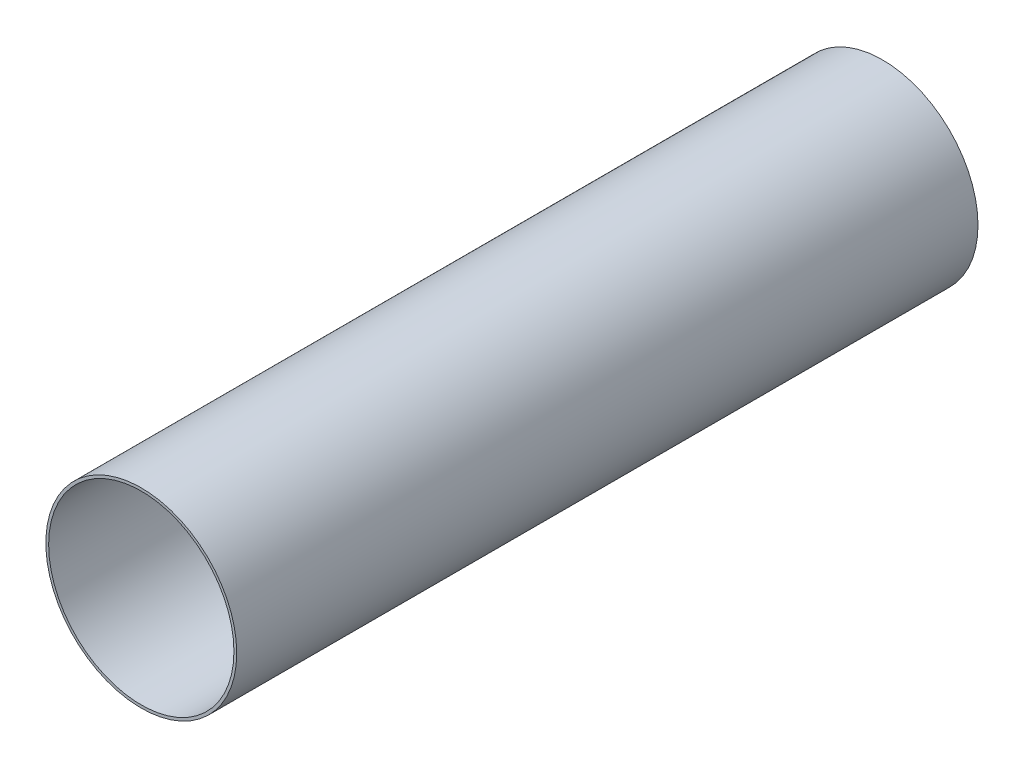
from build123d import *

# Parameters (mm, degrees)
SKETCH1_R           = 65.405
SKETCH1_R_2         = 63.5
BOSS_EXTRUDE1_DEPTH = 254


with BuildPart() as part:
    # Sketch1 → Boss-Extrude1 (new, symmetric)
    with BuildSketch(Plane.XY):
        Circle(SKETCH1_R)
        Circle(SKETCH1_R_2, mode=Mode.SUBTRACT)
    extrude(amount=BOSS_EXTRUDE1_DEPTH, both=True)


solid = part.part
